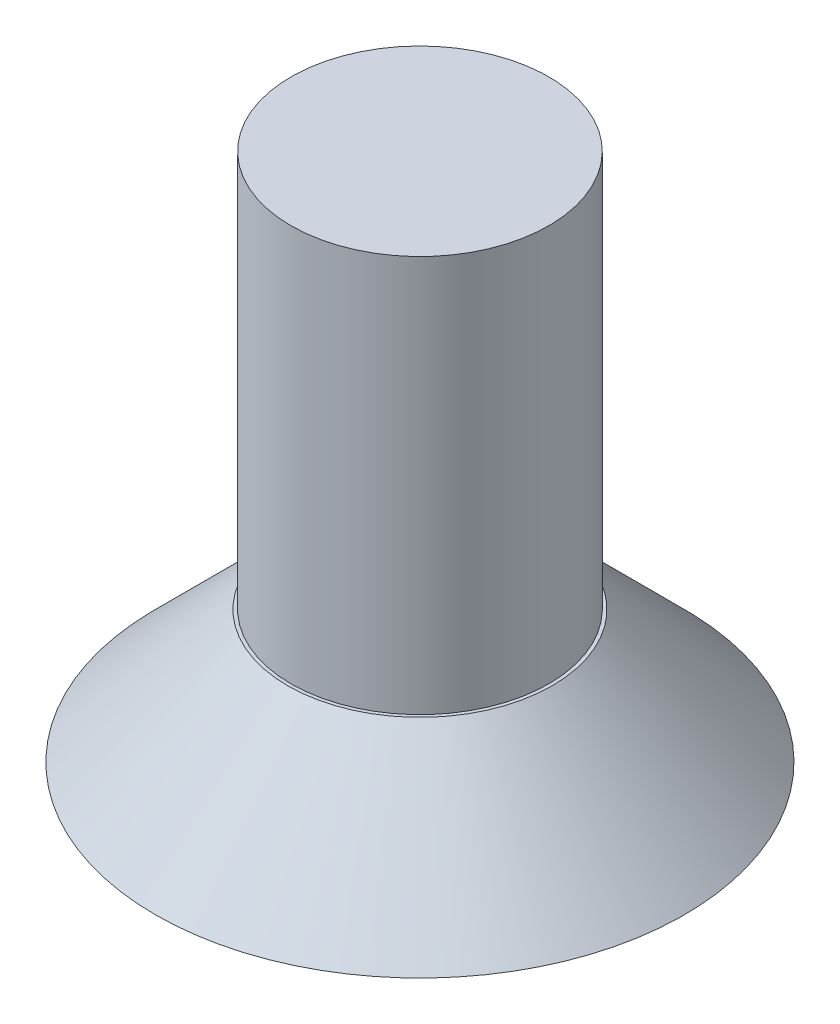
from build123d import *

# Parameters (mm, degrees)
SKETCH1_R           = 4
BOSS_EXTRUDE1_DEPTH = 2
SKETCH2_R           = 1.95
BOSS_EXTRUDE2_DEPTH = 6
CHAMFER1_SIZE       = 2
CUT_EXTRUDE1_DEPTH  = 1.5


with BuildPart() as part:
    # Sketch1 → Boss-Extrude1 (new body)
    with BuildSketch(Plane(origin=(0, 0, 0), x_dir=(1, 0, 0), z_dir=(0, 1, 0))):
        with Locations(Location((0, 0, 0), (0, 0, 270))):
            Circle(SKETCH1_R)
    extrude(amount=BOSS_EXTRUDE1_DEPTH)

    # Sketch2 → Boss-Extrude2 (add)
    with BuildSketch(Plane(origin=(0, 2, 0), x_dir=(1, 0, 0), z_dir=(0, 1, 0))):
        with Locations(Location((0, 0, 0), (0, 0, 270))):
            Circle(SKETCH2_R)
    extrude(amount=BOSS_EXTRUDE2_DEPTH)

    # Chamfer1
    chamfer1_edges = [part.edges().sort_by_distance(p)[0] for p in [
        (0, 2, -4),
    ]]
    chamfer(chamfer1_edges, length=CHAMFER1_SIZE - 0.0001)  # a hair under: the kernel refuses the full size

    # Sketch3 → Cut-Extrude1 (cut)
    with BuildSketch(Plane.XZ):
        Polygon((0, -1.662470902), (1.439742034, -0.831235451), (1.439742034, 0.831235451), (0, 1.662470902), (-1.439742034, 0.831235451), (-1.439742034, -0.831235451), align=None)
    extrude(amount=-CUT_EXTRUDE1_DEPTH, mode=Mode.SUBTRACT)


solid = part.part
